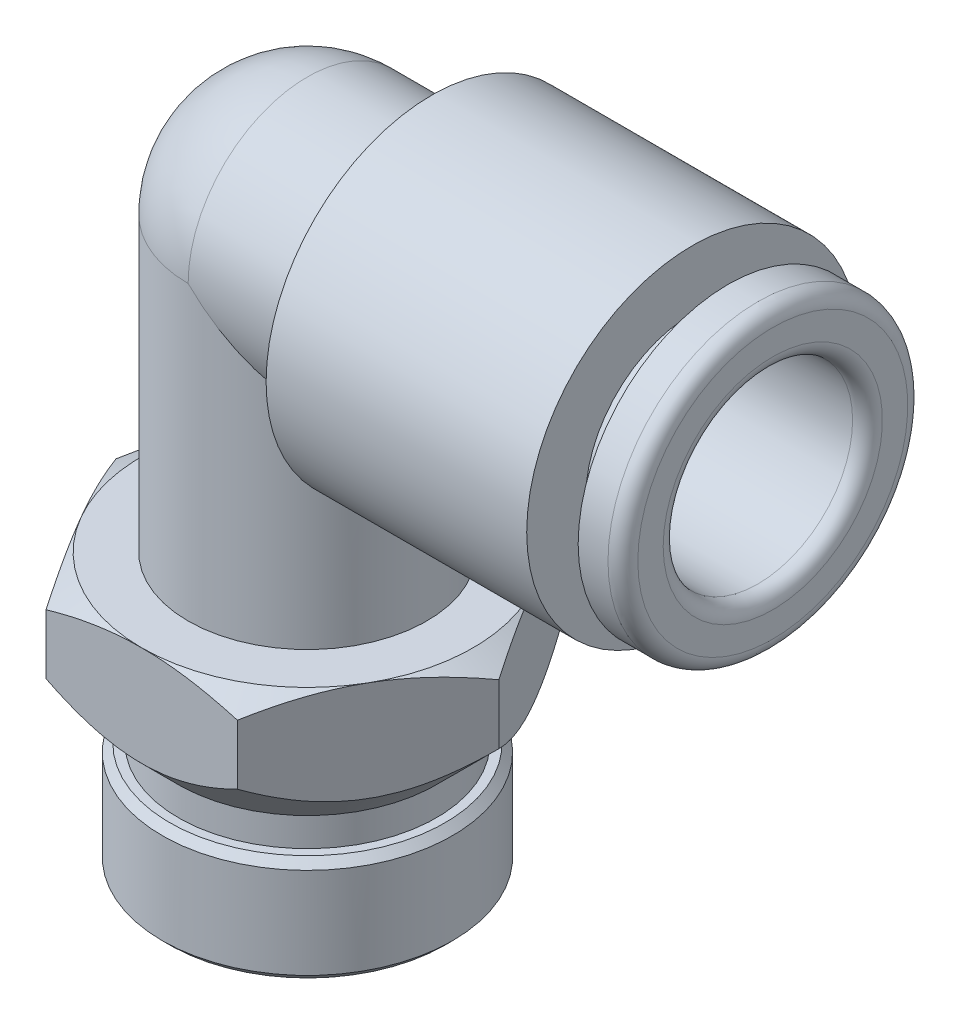
from build123d import *

# Parameters (mm, degrees)
SKETCH1_R             = 4
BASE_EXTRUDE_DEPTH    = 3.6
RBODY_SKETCH_R        = 5.55
RBODY_DEPTH           = 9.3
ELBOW_ANGLE           = 90
SKETCH3_R             = 4
BOSS_EXTRUDE1_DEPTH   = 9.8
NUT_DEPTH             = 4.59
THREAD_CHAMFER_SIZE   = 0.25
RTUBE_START           = -13.3
RTUBE_SKETCH_R        = 3.175
RTUBE_DEPTH           = 13.3
RTUBE_RADIUS_R        = 0.5
DIAMETER_R            = 2.25
PORT_THREADS_REACH    = 31.53
PORT_THREADS_SKETCH_R = 2.25


with BuildPart() as part:
    # Sketch1 → Base-Extrude (new body)
    with BuildSketch(Plane(origin=(0, 0, 0), x_dir=(0, 0, -1), z_dir=(1, 0, 0))):
        with Locations(Location((0, 0, 0), (0, 0, 180))):
            Circle(SKETCH1_R)
    extrude(amount=BASE_EXTRUDE_DEPTH)

    # RBody_Sketch → RBody (add)
    with BuildSketch(Plane(origin=(3.6, 0, 0), x_dir=(0, 0, -1), z_dir=(1, 0, 0))):
        with Locations(Location((0, 0, 0), (0, 0, 180))):
            Circle(RBODY_SKETCH_R)
    extrude(amount=RBODY_DEPTH)

    # RBody_Chamfer: read off the stored shape, not the designer's step
    # RBody_Chamfer outline → RBody_Chamfer (revolve, cut)
    with BuildSketch(Plane.YX):
        Polygon((5.55, 4.164153863), (4, 3.6), (5.55, 3.6), align=None)
    revolve(axis=Axis((0, 0, 0), (1, 0, 0)), mode=Mode.SUBTRACT)

    # RRelease_Sketch → RRelease (revolve)
    with BuildSketch(Plane.XY, mode=Mode.PRIVATE) as rrelease_sk:
        with BuildLine():
            Line((12.9, 3.575), (14.1, 3.575))
            Line((14.1, 3.575), (14.1, 5.025))
            Line((14.1, 5.025), (15.1, 5.025))
            ThreePointArc((15.1, 5.025), (15.453553391, 4.878553391), (15.6, 4.525))
            Line((15.6, 4.525), (15.6, 0))
            Line((15.6, 0), (12.9, 0))
            Line((12.9, 0), (12.9, 3.575))
        make_face()
    revolve(rrelease_sk.sketch.rotate(Axis((12.597722381, 0, 0), (1, 0, 0)), 90), axis=Axis((12.597722381, 0, 0), (1, 0, 0)))

    # Elbow_Sketch → Elbow (revolve)
    with BuildSketch(Plane.ZY):
        with BuildLine():
            Line((-4, 0), (4, 0))
            ThreePointArc((4, 0), (0, 4), (-4, 0))
        make_face()
    revolve(axis=Axis((0, 0, -6.487672297), (0, 0, 1)), revolution_arc=ELBOW_ANGLE)

    # Sketch3 → Boss-Extrude1 (add)
    with BuildSketch(Plane.XZ):
        with Locations(Location((0, 0, 0), (0, 0, 90))):
            Circle(SKETCH3_R)
    extrude(amount=BOSS_EXTRUDE1_DEPTH)

    # Nut_Sketch → Nut (add)
    with BuildSketch(Plane(origin=(0, -14.39, 0), x_dir=(-1, 0, 0), z_dir=(0, 1, 0))):
        Polygon((6.414361491, 0), (3.207180745, 5.555), (-3.207180745, 5.555), (-6.414361491, 0), (-3.207180745, -5.555), (3.207180745, -5.555), align=None)
    extrude(amount=NUT_DEPTH)

    # Nut_Chamfer_Sketch → Nut_Chamfer (revolve, cut)
    with BuildSketch(Plane.XY):
        Polygon((-5.555, -9.8), (-6.414361491, -9.8), (-6.414361491, -10.296152588), align=None)
        Polygon((-6.414361491, -13.893847412), (-5.555, -14.39), (-6.414361491, -14.39), align=None)
    revolve(axis=Axis((0, -1.551633987, 0), (0, 1, 0)), mode=Mode.SUBTRACT)

    # Thread_Sketch → Thread (revolve)
    with BuildSketch(Plane.XY):
        Polygon((0, -14.39), (-4.325, -14.39), (-4.325, -15.35), (-4.864, -15.35), (-4.864, -18.9), (0, -18.9), align=None)
    revolve(axis=Axis((0, 0, 0), (0, -1, 0)))

    # Thread_Chamfer
    thread_chamfer_edges = [part.edges().sort_by_distance(p)[0] for p in [
        (4.864, -18.9, 0),
        (4.864, -15.35, 0),
    ]]
    chamfer(thread_chamfer_edges, length=THREAD_CHAMFER_SIZE)

    # Sketch6 → Cut-Revolve1 (revolve, cut)
    with BuildSketch(Plane.XY):
        Polygon((-4.325, -14.39), (-6.414361491, -14.39), (-6.414361491, -12.300638509), align=None)
    revolve(axis=Axis((0, -7.772283854, 0), (0, -1, 0)), mode=Mode.SUBTRACT)

    # RTube_Sketch → RTube (cut)
    with BuildSketch(Plane(origin=(15.6, 0, 0), x_dir=(0, 0, -1), z_dir=(1, 0, 0)).offset(RTUBE_START)):
        Circle(RTUBE_SKETCH_R)
    extrude(amount=RTUBE_DEPTH, mode=Mode.SUBTRACT)

    # RTube_Radius
    rtube_radius_edges = [part.edges().sort_by_distance(p)[0] for p in [
        (15.6, 0, 3.175),
    ]]
    fillet(rtube_radius_edges, radius=RTUBE_RADIUS_R)

    # Port_Curve: sweep along a path in Profile
    with BuildLine(Plane.XY) as port_curve_path:
        ThreePointArc((2.3, 0), (0.673654403, -0.673654403), (0, -2.3))
    # Diameter → Port_Curve (sweep, cut)
    with BuildSketch(Plane(origin=(2.3, 0, 0), x_dir=(0, 0, -1), z_dir=(1, 0, 0))):
        Circle(DIAMETER_R)
    sweep(path=port_curve_path.line, mode=Mode.SUBTRACT)

    # Port_Threads_Sketch → Port_Threads (cut, up to next)
    with BuildSketch(Plane(origin=(0, -18.9, 0), x_dir=(-1, 0, 0), z_dir=(0, 1, 0)), mode=Mode.PRIVATE) as port_threads_sk1:
        Circle(PORT_THREADS_SKETCH_R)
    port_threads_tool1 = extrude(port_threads_sk1.sketch, amount=PORT_THREADS_REACH, mode=Mode.PRIVATE) & part.part
    add(port_threads_tool1.solids().sort_by_distance((0, -18.9, 0))[0], mode=Mode.SUBTRACT)


solid = part.part
